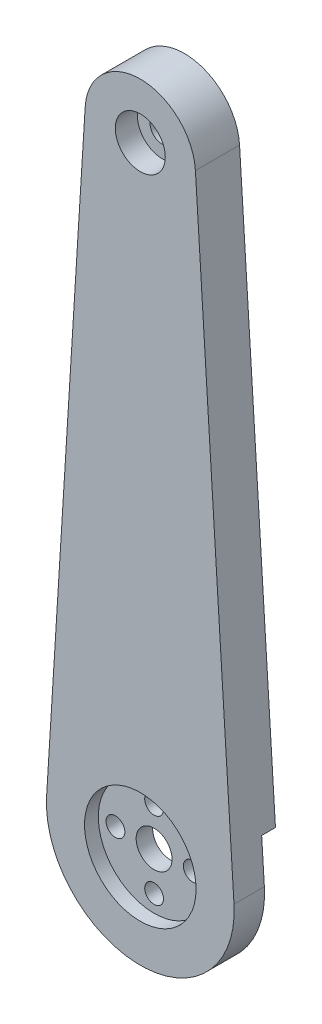
from build123d import *

# Parameters (mm, degrees)
SKETCH1_R           = 3.25
SKETCH1_R_2         = 1.7
SKETCH1_R_3         = 2.25
BOSS_EXTRUDE1_DEPTH = 8
SKETCH2_R           = 10.1
CUT_EXTRUDE1_DEPTH  = 2.5
SKETCH3_R           = 4.525
CUT_EXTRUDE2_DEPTH  = 4
CUT_EXTRUDE3_DEPTH  = 2.5


with BuildPart() as part:
    # Sketch1 → Boss-Extrude1 (new body)
    with BuildSketch(Plane.XY):
        with BuildLine():
            Line((16.967, 1.062), (9.98, 112.625))
            ThreePointArc((9.98, 112.625), (0, 121.99955124), (-9.98, 112.625))
            Line((-9.98, 112.625), (-16.967, 1.062))
            ThreePointArc((-16.967, 1.062), (0, -17.000203911), (16.967, 1.062))
        make_face()
        Circle(SKETCH1_R, mode=Mode.SUBTRACT)
        with Locations((7, 0)):
            Circle(SKETCH1_R_2, mode=Mode.SUBTRACT)
        with Locations((0, 7)):
            Circle(SKETCH1_R_2, mode=Mode.SUBTRACT)
        with Locations((-7, 0)):
            Circle(SKETCH1_R_2, mode=Mode.SUBTRACT)
        with Locations((0, -7)):
            Circle(SKETCH1_R_2, mode=Mode.SUBTRACT)
        with Locations((0, 112)):
            Circle(SKETCH1_R_3, mode=Mode.SUBTRACT)
    extrude(amount=BOSS_EXTRUDE1_DEPTH)

    # Sketch2 → Cut-Extrude1 (cut)
    with BuildSketch(Plane.XY.offset(8)):
        Circle(SKETCH2_R)
    extrude(amount=-CUT_EXTRUDE1_DEPTH, mode=Mode.SUBTRACT)

    # Sketch3 → Cut-Extrude2 (cut)
    with BuildSketch(Plane.XY.offset(8)):
        with Locations((0, 112)):
            Circle(SKETCH3_R)
    extrude(amount=-CUT_EXTRUDE2_DEPTH, mode=Mode.SUBTRACT)

    # Sketch4 → Cut-Extrude3 (cut)
    with BuildSketch(Plane.XY):
        with BuildLine():
            Line((13.45, 13), (7.7, 103))
            ThreePointArc((7.7, 103), (0, 100.155592037), (-7.7, 103))
            Line((-7.7, 103), (-13.45, 13))
            ThreePointArc((-13.45, 13), (0, -18.705680955), (13.45, 13))
        make_face()
    extrude(amount=CUT_EXTRUDE3_DEPTH, mode=Mode.SUBTRACT)


solid = part.part
